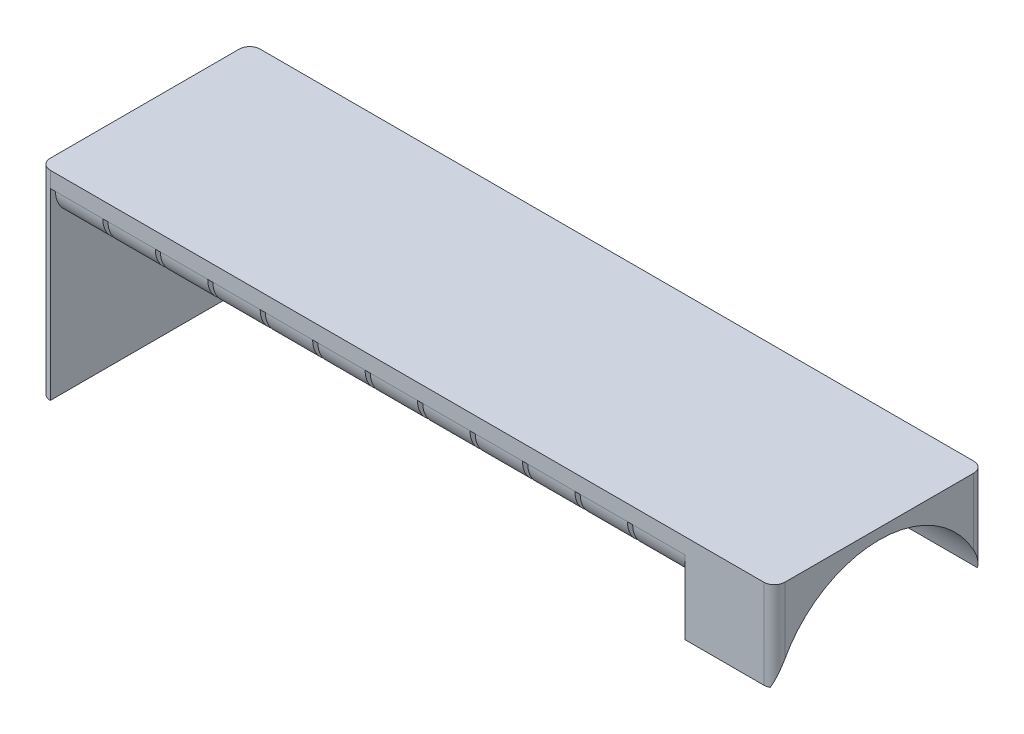
from build123d import *
from build123d.topology import SkipClean

# Parameters (mm, degrees)
SKETCH1_W           = 123
SKETCH1_H           = 40
SKETCH1_W_2         = 15
SKETCH1_W_3         = 2
BOSS_EXTRUDE1_DEPTH = 8
SKETCH1_3_W         = 15
SKETCH1_3_H         = 40
BOSS_EXTRUDE2_DEPTH = 9
SKETCH2_W           = 10.875
SKETCH2_H           = 9
BOSS_EXTRUDE3_DEPTH = 1
BOSS_EXTRUDE4_START = 1
SKETCH2_3_W         = 10.875
SKETCH2_3_H         = 9
SKETCH2_3_W_2       = 17.05
SKETCH2_3_H_2       = 0.6
BOSS_EXTRUDE4_DEPTH = 1
SKETCH1_4_W         = 2
SKETCH1_4_H         = 40
BOSS_EXTRUDE5_DEPTH = 30
SKETCH3_R           = 12.1
CUT_EXTRUDE1_DEPTH  = 119
FILLET1_R           = 5
FILLET2_START       = -31
FILLET2_DEPTH       = 40
BOSS_EXTRUDE6_START = -2
BOSS_EXTRUDE6_DEPTH = 121
FILLET3_R           = 0.5
FILLET5_R           = 1
SKETCH4_W           = 40
SKETCH4_H           = 10
CUT_EXTRUDE2_DEPTH  = 1
LPATTERN1_COUNT     = 13
LPATTERN1_PITCH     = 10
SKETCH5_R           = 20.5
CUT_EXTRUDE3_DEPTH  = 129.175660716


with BuildPart() as part:
    # Sketch1 → Boss-Extrude1 (new body)
    with BuildSketch(Plane(origin=(0, 0, 0), x_dir=(1, 0, 0), z_dir=(0, 1, 0))):
        with Locations((-6.5, 0)):
            Rectangle(SKETCH1_W, SKETCH1_H)
        with Locations((62.5, 0)):
            Rectangle(SKETCH1_W_2, SKETCH1_H)
        with Locations((-69, 0)):
            Rectangle(SKETCH1_W_3, SKETCH1_H)
    extrude(amount=BOSS_EXTRUDE1_DEPTH)

    # Sketch1<3> → Boss-Extrude2 (add)
    with BuildSketch(Plane(origin=(0, 0, 0), x_dir=(1, 0, 0), z_dir=(0, 1, 0))):
        with Locations((62.5, 0)):
            Rectangle(SKETCH1_3_W, SKETCH1_3_H)
    extrude(amount=-BOSS_EXTRUDE2_DEPTH)

    # Sketch2 → Boss-Extrude3 (add)
    with BuildSketch(Plane.ZY.offset(-55)):
        with Locations((14.5625, -4.5)):
            Rectangle(SKETCH2_W, SKETCH2_H)
        with Locations((-14.5625, -4.5)):
            Rectangle(SKETCH2_W, SKETCH2_H)
    extrude(amount=BOSS_EXTRUDE3_DEPTH)

    # Sketch2<3> → Boss-Extrude4 (add)
    with BuildSketch(Plane.ZY.offset(-55).offset(BOSS_EXTRUDE4_START)):
        Polygon((9.125, -9), (9.125, 0), (8.525, 0), (8.525, -0.6), (8.525, -9), align=None)
        with Locations((14.5625, -4.5)):
            Rectangle(SKETCH2_3_W, SKETCH2_3_H)
        with Locations((0, -0.3)):
            Rectangle(SKETCH2_3_W_2, SKETCH2_3_H_2)
        Polygon((-8.525, -0.6), (-8.525, 0), (-9.125, 0), (-9.125, -9), (-8.525, -9), align=None)
        with Locations((-14.5625, -4.5)):
            Rectangle(SKETCH2_3_W, SKETCH2_3_H)
    extrude(amount=BOSS_EXTRUDE4_DEPTH)

    # Sketch1<4> → Boss-Extrude5 (add)
    with BuildSketch(Plane(origin=(0, 0, 0), x_dir=(1, 0, 0), z_dir=(0, 1, 0))):
        with Locations((-69, 0)):
            Rectangle(SKETCH1_4_W, SKETCH1_4_H)
    extrude(amount=-BOSS_EXTRUDE5_DEPTH)

    # Sketch3 → Cut-Extrude1 (cut)
    with BuildSketch(Plane.ZY.offset(-51)):
        with Locations((0, -6.5)):
            Circle(SKETCH3_R)
    extrude(amount=CUT_EXTRUDE1_DEPTH, mode=Mode.SUBTRACT)

    # Fillet1
    fillet1_edges = [part.edges().sort_by_distance(p)[0] for p in [
        (-7.5, 0, -20),
        (-7.5, 0, 20),
    ]]
    fillet(fillet1_edges, radius=FILLET1_R)

    # Fillet2: read off the stored shape, not the designer's step
    # Fillet2 outline → Fillet2 (cut)
    with BuildSketch(Plane(origin=(0, 0, 0), x_dir=(1, 0, 0), z_dir=(0, 1, 0)).offset(FILLET2_START)):
        with BuildLine():
            Line((-70, -20), (-68, -20))
            ThreePointArc((-68, -20), (-69.414213562, -19.414213562), (-70, -18))
            Line((-70, -18), (-70, -20))
        make_face()
        with BuildLine():
            ThreePointArc((70, -18), (69.414213562, -19.414213562), (68, -20))
            Line((68, -20), (70, -20))
            Line((70, -20), (70, -18))
        make_face()
        with BuildLine():
            Line((-70, 20), (-70, 18))
            ThreePointArc((-70, 18), (-69.414213562, 19.414213562), (-68, 20))
            Line((-68, 20), (-70, 20))
        make_face()
        with BuildLine():
            ThreePointArc((68, 20), (69.414213562, 19.414213562), (70, 18))
            Line((70, 18), (70, 20))
            Line((70, 20), (68, 20))
        make_face()
    extrude(amount=FILLET2_DEPTH, mode=Mode.SUBTRACT)

    # Sketch3<3> → Boss-Extrude6 (add)
    with SkipClean():  # the faces are left unmerged after this step: merging them gives an invalid solid
        with BuildSketch(Plane.ZY.offset(-51).offset(BOSS_EXTRUDE6_START)):
            with BuildLine():
                Line((-11.655363572, 0), (-11.655363572, -3.25))
                ThreePointArc((-11.655363572, -3.25), (-11.050752229, -1.571422601), (-10.205880658, 0))
                Line((-10.205880658, 0), (-11.655363572, 0))
            make_face()
            with BuildLine():
                ThreePointArc((10.205880658, 0), (11.050752229, -1.571422601), (11.655363572, -3.25))
                Line((11.655363572, -3.25), (11.655363572, 0))
                Line((11.655363572, 0), (10.205880658, 0))
            make_face()
        extrude(amount=BOSS_EXTRUDE6_DEPTH)

    # Fillet3
    fillet3_edges = [part.edges().sort_by_distance(p)[0] for p in [
        (-7.5, -3.25, -11.655363572),
        (-7.5, -3.25, 11.655363572),
    ]]
    fillet(fillet3_edges, radius=FILLET3_R)

    # Fillet5
    # the kernel refuses this fillet: 1 mm, written as the material it takes off along each edge
    with BuildSketch(Plane(origin=(51, 0, -12.705880658), x_dir=(1, 0, 0), z_dir=(0, 0, 1))) as fillet5_piece_1_section:
        with BuildLine():
            CenterArc((FILLET5_R, FILLET5_R), FILLET5_R, 180, 90)
            Line((0, FILLET5_R), (0, 0))
            Line((0, 0), (FILLET5_R, 0))
        make_face()
    fillet5_piece_1 = extrude(amount=25.411761315, mode=Mode.PRIVATE)
    fillet5_piece_1 = fillet5_piece_1 & Plane(origin=(51, -6.5, 0), x_dir=(0, 0.2685950413223157, -0.9632531877845324), z_dir=(1, 0, 0)) * Cylinder(12.1, 55, mode=Mode.PRIVATE)
    add(fillet5_piece_1, mode=Mode.SUBTRACT)

    # Sketch4 → Cut-Extrude2 (cut)
    with BuildSketch(Plane.ZY.offset(-43)):
        Rectangle(SKETCH4_W, SKETCH4_H)
    cut_extrude2 = extrude(amount=CUT_EXTRUDE2_DEPTH, mode=Mode.SUBTRACT)

    # LPattern1: Cut-Extrude2 ×13
    with Locations(*[(-i * LPATTERN1_PITCH, 0, 0) for i in range(1, LPATTERN1_COUNT)]):
        add(cut_extrude2, mode=Mode.SUBTRACT)

    # Sketch5 → Cut-Extrude3 (cut, through all)
    with BuildSketch(Plane.ZY.offset(-53)):
        with Locations((0, -14.511337162)):
            Circle(SKETCH5_R)
    extrude(amount=-CUT_EXTRUDE3_DEPTH, mode=Mode.SUBTRACT)


solid = part.part
